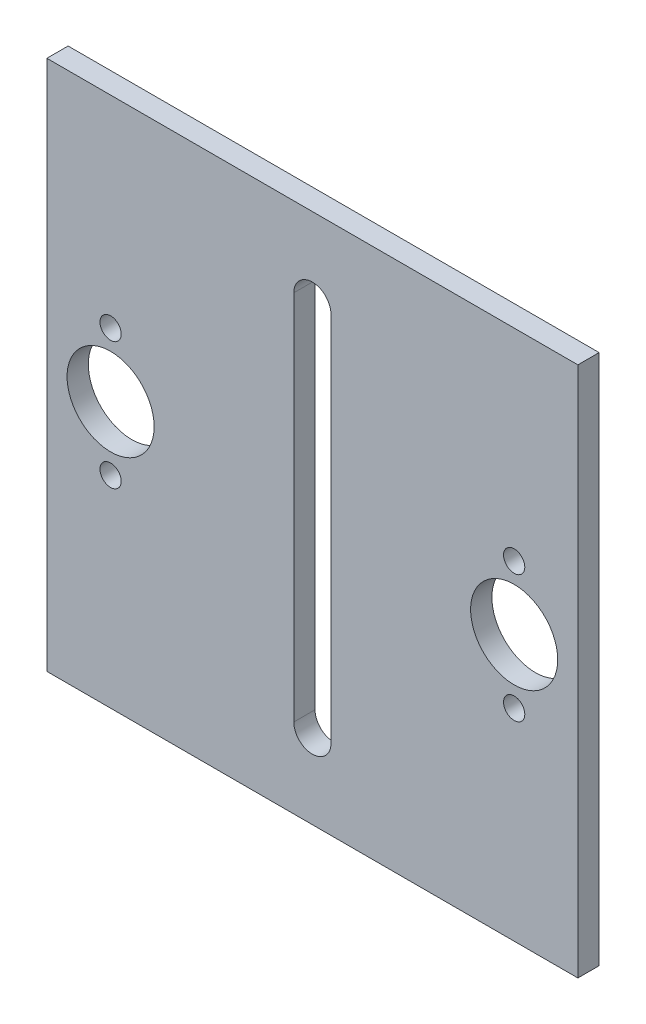
from build123d import *

# Parameters (mm, degrees)
SKETCH1_W                = 50
SKETCH1_H                = 50
PLATE_BODY_DEPTH         = 2
SKETCH2_R                = 4.1
SHAFT_BEARINGS_DEPTH     = 71.738956735
SKETCH3_R                = 1
BEARING_BOLT_HOLES_DEPTH = 71.738956735
CUT_EXTRUDE1_DEPTH       = 71.738956735


with BuildPart() as part:
    # Sketch1 → plate_body (new body)
    with BuildSketch(Plane.XY):
        with Locations((25, 25)):
            Rectangle(SKETCH1_W, SKETCH1_H)
    extrude(amount=PLATE_BODY_DEPTH)

    # Sketch2 → shaft_bearings (cut, through all)
    with BuildSketch(Plane.XY.offset(2)):
        with Locations((6, 25)):
            Circle(SKETCH2_R)
        with Locations((44, 25)):
            Circle(SKETCH2_R)
    extrude(amount=-SHAFT_BEARINGS_DEPTH, mode=Mode.SUBTRACT)

    # Sketch3 → bearing_bolt_holes (cut, through all)
    with BuildSketch(Plane.XY.offset(2)):
        with Locations((6, 31)):
            Circle(SKETCH3_R)
        with Locations((6, 19)):
            Circle(SKETCH3_R)
        with Locations((44, 31)):
            Circle(SKETCH3_R)
        with Locations((44, 19)):
            Circle(SKETCH3_R)
    extrude(amount=-BEARING_BOLT_HOLES_DEPTH, mode=Mode.SUBTRACT)

    # Sketch4 → Cut-Extrude1 (cut, through all)
    with BuildSketch(Plane.XY.offset(2)):
        with BuildLine():
            Line((26.75, 42.5), (26.75, 7.5))
            ThreePointArc((26.75, 7.5), (25, 5.75), (23.25, 7.5))
            Line((23.25, 7.5), (23.25, 42.5))
            ThreePointArc((23.25, 42.5), (25, 44.25), (26.75, 42.5))
        make_face()
    extrude(amount=-CUT_EXTRUDE1_DEPTH, mode=Mode.SUBTRACT)


solid = part.part
